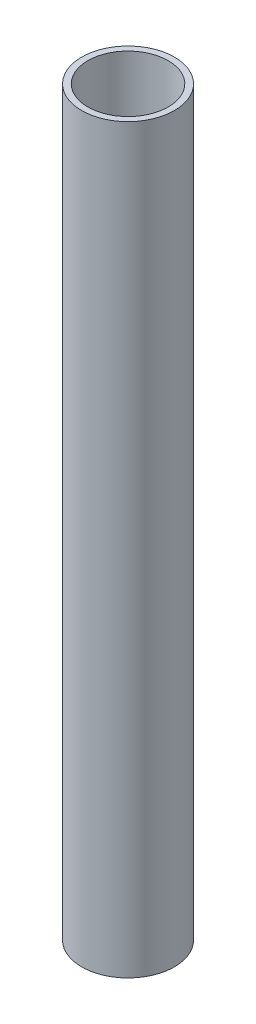
from build123d import *

# Parameters (mm, degrees)
SKETCH1_R           = 9.525
SKETCH1_R_2         = 8.255
BOSS_EXTRUDE1_DEPTH = 152.4


with BuildPart() as part:
    # Sketch1 → Boss-Extrude1 (new body)
    with BuildSketch(Plane(origin=(0, 0, 0), x_dir=(1, 0, 0), z_dir=(0, 1, 0))):
        Circle(SKETCH1_R)
        Circle(SKETCH1_R_2, mode=Mode.SUBTRACT)
    extrude(amount=BOSS_EXTRUDE1_DEPTH)


solid = part.part
